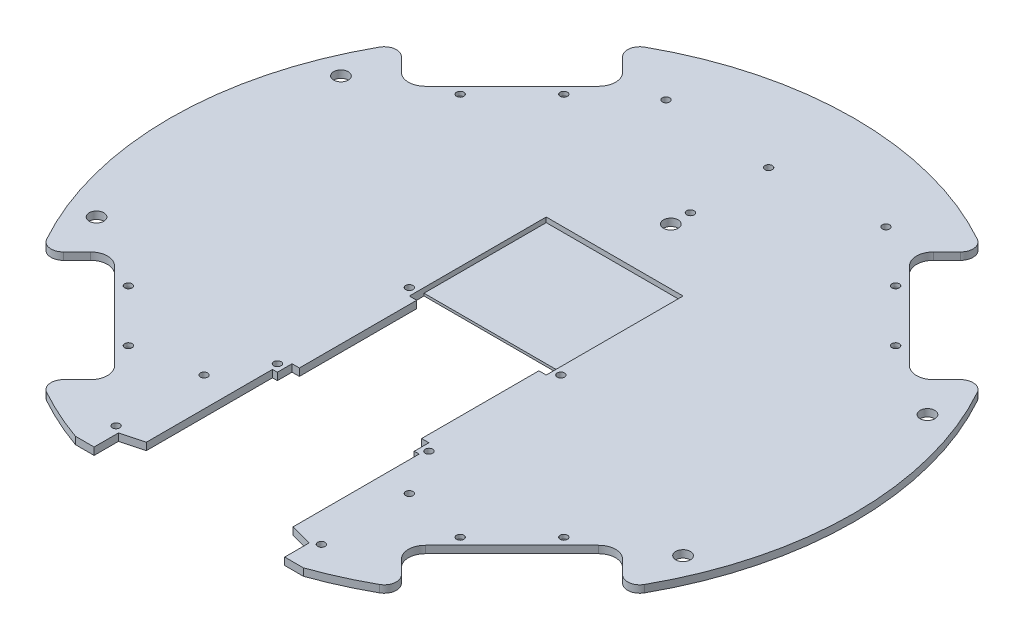
from build123d import *

# Parameters (mm, degrees)
SKETCH1_R                = 140
BOSS_EXTRUDE1_DEPTH      = 3
CUT_EXTRUDE4_REACH       = 200.013
CUT_EXTRUDE6_REACH       = 200.013
SKETCH9_R                = 1.5
FILLET1_R                = 5
CIRPATTERN1_COUNT        = 4
FILLET1_OF_CIRPATTERN1_R = 5
CUT_EXTRUDE1_REACH       = 200.013
FILLET3_R                = 1.5
CUT_EXTRUDE7_REACH       = 200.013
SKETCH10_R               = 1.5
CUT_EXTRUDE9_REACH       = 200.013
SKETCH13_R               = 1.5
CUT_EXTRUDE12_REACH      = 200.013
SKETCH16_R               = 1.5
SKETCH16_R_2             = 3
CUT_EXTRUDE13_REACH      = 200.013
SKETCH17_R               = 3
SKETCH18_W               = 56
SKETCH18_H               = 50
CUT_EXTRUDE14_DEPTH      = 2


with BuildPart() as part:
    # Sketch1 → Boss-Extrude1 (new body)
    with BuildSketch(Plane(origin=(0, 0, 0), x_dir=(1, 0, 0), z_dir=(0, 1, 0))):
        Circle(SKETCH1_R)
    extrude(amount=BOSS_EXTRUDE1_DEPTH)

    # Sketch7 → Cut-Extrude4 (cut, up to next)
    with BuildSketch(Plane(origin=(0, 3, 0), x_dir=(1, 0, 0), z_dir=(0, 1, 0)), mode=Mode.PRIVATE) as cut_extrude4_sk1:
        with BuildLine():
            Line((-99.030304705, -63.604254968), (-63.604254968, -99.030304705))
            ThreePointArc((-63.604254968, -99.030304705), (-61.568647097, -103.944696834), (-63.604254968, -108.859088964))
            Line((-63.604254968, -108.859088964), (-76.367532368, -121.622366364))
            Line((-76.367532368, -121.622366364), (-121.622366364, -76.367532368))
            Line((-121.622366364, -76.367532368), (-108.859088964, -63.604254968))
            ThreePointArc((-108.859088964, -63.604254968), (-103.944696834, -61.568647097), (-99.030304705, -63.604254968))
        make_face()
    cut_extrude4_tool1 = extrude(cut_extrude4_sk1.sketch, amount=-CUT_EXTRUDE4_REACH, mode=Mode.PRIVATE) & part.part
    cut_extrude4 = cut_extrude4_tool1.solids().sort_by_distance((-90.257735, 3, 90.257735))[0]
    add(cut_extrude4, mode=Mode.SUBTRACT)

    # Sketch9 → Cut-Extrude6 (cut, up to next)
    with BuildSketch(Plane(origin=(0, 3, 0), x_dir=(1, 0, 0), z_dir=(0, 1, 0)), mode=Mode.PRIVATE) as cut_extrude6_sk1:
        with Locations((-89.09545443, -67.882250994)):
            Circle(SKETCH9_R)
    cut_extrude6_tool1 = extrude(cut_extrude6_sk1.sketch, amount=-CUT_EXTRUDE6_REACH, mode=Mode.PRIVATE) & part.part
    # Sketch9 → Cut-Extrude6 (cut, up to next)
    with BuildSketch(Plane(origin=(0, 3, 0), x_dir=(1, 0, 0), z_dir=(0, 1, 0)), mode=Mode.PRIVATE) as cut_extrude6_sk2:
        with Locations((-67.882250994, -89.09545443)):
            Circle(SKETCH9_R)
    cut_extrude6_tool2 = extrude(cut_extrude6_sk2.sketch, amount=-CUT_EXTRUDE6_REACH, mode=Mode.PRIVATE) & part.part
    cut_extrude6_1 = cut_extrude6_tool1.solids().sort_by_distance((-89.095454, 3, 67.882251))[0]
    add(cut_extrude6_1, mode=Mode.SUBTRACT)
    cut_extrude6_2 = cut_extrude6_tool2.solids().sort_by_distance((-67.882251, 3, 89.095454))[0]
    add(cut_extrude6_2, mode=Mode.SUBTRACT)
    cut_extrude6 = cut_extrude6_1 + cut_extrude6_2  # Cut-Extrude6 as one shape, for the pattern or mirror that repeats it

    # Fillet1
    fillet1_edges = [part.edges().sort_by_distance(p)[0] for p in [
        (-73.746853427, 1.5, 119.001687423),
        (-119.001687423, 1.5, 73.746853427),
    ]]
    fillet(fillet1_edges, radius=FILLET1_R)

    # CirPattern1: Cut-Extrude4, Cut-Extrude6 ×4 about axis
    cirpattern1_axis = Axis((0, 3, 0), (0, 1, 0))
    add([cut_extrude4.rotate(cirpattern1_axis, i * 360 / CIRPATTERN1_COUNT) for i in range(1, CIRPATTERN1_COUNT)], mode=Mode.SUBTRACT)
    add([cut_extrude6.rotate(cirpattern1_axis, i * 360 / CIRPATTERN1_COUNT) for i in range(1, CIRPATTERN1_COUNT)], mode=Mode.SUBTRACT)

    # Fillet1 of CirPattern1
    fillet1_of_cirpattern1_edges = [part.edges().sort_by_distance(p)[0] for p in [
        (119.001687423, 1.5, 73.746853427),
        (73.746853427, 1.5, 119.001687423),
        (73.746853427, 1.5, -119.001687423),
        (119.001687423, 1.5, -73.746853427),
        (-119.001687423, 1.5, -73.746853427),
        (-73.746853427, 1.5, -119.001687423),
    ]]
    fillet(fillet1_of_cirpattern1_edges, radius=FILLET1_OF_CIRPATTERN1_R)

    # Sketch2 → Cut-Extrude1 (cut, up to next)
    with BuildSketch(Plane(origin=(0, 3, 0), x_dir=(1, 0, 0), z_dir=(0, 1, 0)), mode=Mode.PRIVATE) as cut_extrude1_sk1:
        Polygon((-46.647615159, -132), (-39, -132), (-39, -122), (-30, -119.588457268), (-30, -68), (-28, -68), (-28, -62), (-25, -62), (-25, -14), (-28, -14), (-28, -8), (28, -8), (28, -14), (25, -14), (25, -62), (28, -62), (28, -68), (30, -68), (30, -119.588457268), (39, -122), (39, -132), (46.647615159, -132), (46.647615159, -140), (-46.647615159, -140), align=None)
    cut_extrude1_tool1 = extrude(cut_extrude1_sk1.sketch, amount=-CUT_EXTRUDE1_REACH, mode=Mode.PRIVATE) & part.part
    add(cut_extrude1_tool1.solids().sort_by_distance((0, 3, 79.863408))[0], mode=Mode.SUBTRACT)

    # Fillet3
    fillet3_edges = [part.edges().sort_by_distance(p)[0] for p in [
        (67.882250994, 0, 90.59545443),
        (89.09545443, 0, 69.382250994),
        (90.59545443, 0, -67.882250994),
        (69.382250994, 0, -89.09545443),
        (-67.882250994, 0, -90.59545443),
        (-89.09545443, 0, -69.382250994),
        (-69.382250994, 0, 89.09545443),
        (-90.59545443, 0, 67.882250994),
    ]]
    fillet(fillet3_edges, radius=FILLET3_R)

    # Sketch10 → Cut-Extrude7 (cut, up to next)
    with BuildSketch(Plane(origin=(0, 3, 0), x_dir=(1, 0, 0), z_dir=(0, 1, 0)), mode=Mode.PRIVATE) as cut_extrude7_sk1:
        with Locations((-31, -65)):
            Circle(SKETCH10_R)
    cut_extrude7_tool1 = extrude(cut_extrude7_sk1.sketch, amount=-CUT_EXTRUDE7_REACH, mode=Mode.PRIVATE) & part.part
    # Sketch10 → Cut-Extrude7 (cut, up to next)
    with BuildSketch(Plane(origin=(0, 3, 0), x_dir=(1, 0, 0), z_dir=(0, 1, 0)), mode=Mode.PRIVATE) as cut_extrude7_sk2:
        with Locations((31, -65)):
            Circle(SKETCH10_R)
    cut_extrude7_tool2 = extrude(cut_extrude7_sk2.sketch, amount=-CUT_EXTRUDE7_REACH, mode=Mode.PRIVATE) & part.part
    # Sketch10 → Cut-Extrude7 (cut, up to next)
    with BuildSketch(Plane(origin=(0, 3, 0), x_dir=(1, 0, 0), z_dir=(0, 1, 0)), mode=Mode.PRIVATE) as cut_extrude7_sk3:
        with Locations((-31, -11)):
            Circle(SKETCH10_R)
    cut_extrude7_tool3 = extrude(cut_extrude7_sk3.sketch, amount=-CUT_EXTRUDE7_REACH, mode=Mode.PRIVATE) & part.part
    # Sketch10 → Cut-Extrude7 (cut, up to next)
    with BuildSketch(Plane(origin=(0, 3, 0), x_dir=(1, 0, 0), z_dir=(0, 1, 0)), mode=Mode.PRIVATE) as cut_extrude7_sk4:
        with Locations((31, -11)):
            Circle(SKETCH10_R)
    cut_extrude7_tool4 = extrude(cut_extrude7_sk4.sketch, amount=-CUT_EXTRUDE7_REACH, mode=Mode.PRIVATE) & part.part
    add(cut_extrude7_tool1.solids().sort_by_distance((-31, 3, 65))[0], mode=Mode.SUBTRACT)
    add(cut_extrude7_tool2.solids().sort_by_distance((31, 3, 65))[0], mode=Mode.SUBTRACT)
    add(cut_extrude7_tool3.solids().sort_by_distance((-31, 3, 11))[0], mode=Mode.SUBTRACT)
    add(cut_extrude7_tool4.solids().sort_by_distance((31, 3, 11))[0], mode=Mode.SUBTRACT)

    # Sketch13 → Cut-Extrude9 (cut, up to next)
    with BuildSketch(Plane(origin=(0, 3, 0), x_dir=(1, 0, 0), z_dir=(0, 1, 0)), mode=Mode.PRIVATE) as cut_extrude9_sk1:
        with Locations((-42, -84)):
            Circle(SKETCH13_R)
    cut_extrude9_tool1 = extrude(cut_extrude9_sk1.sketch, amount=-CUT_EXTRUDE9_REACH, mode=Mode.PRIVATE) & part.part
    # Sketch13 → Cut-Extrude9 (cut, up to next)
    with BuildSketch(Plane(origin=(0, 3, 0), x_dir=(1, 0, 0), z_dir=(0, 1, 0)), mode=Mode.PRIVATE) as cut_extrude9_sk2:
        with Locations((-42, -120)):
            Circle(SKETCH13_R)
    cut_extrude9_tool2 = extrude(cut_extrude9_sk2.sketch, amount=-CUT_EXTRUDE9_REACH, mode=Mode.PRIVATE) & part.part
    # Sketch13 → Cut-Extrude9 (cut, up to next)
    with BuildSketch(Plane(origin=(0, 3, 0), x_dir=(1, 0, 0), z_dir=(0, 1, 0)), mode=Mode.PRIVATE) as cut_extrude9_sk3:
        with Locations((42, -120)):
            Circle(SKETCH13_R)
    cut_extrude9_tool3 = extrude(cut_extrude9_sk3.sketch, amount=-CUT_EXTRUDE9_REACH, mode=Mode.PRIVATE) & part.part
    # Sketch13 → Cut-Extrude9 (cut, up to next)
    with BuildSketch(Plane(origin=(0, 3, 0), x_dir=(1, 0, 0), z_dir=(0, 1, 0)), mode=Mode.PRIVATE) as cut_extrude9_sk4:
        with Locations((42, -84)):
            Circle(SKETCH13_R)
    cut_extrude9_tool4 = extrude(cut_extrude9_sk4.sketch, amount=-CUT_EXTRUDE9_REACH, mode=Mode.PRIVATE) & part.part
    add(cut_extrude9_tool1.solids().sort_by_distance((-42, 3, 84))[0], mode=Mode.SUBTRACT)
    add(cut_extrude9_tool2.solids().sort_by_distance((-42, 3, 120))[0], mode=Mode.SUBTRACT)
    add(cut_extrude9_tool3.solids().sort_by_distance((42, 3, 120))[0], mode=Mode.SUBTRACT)
    add(cut_extrude9_tool4.solids().sort_by_distance((42, 3, 84))[0], mode=Mode.SUBTRACT)

    # Sketch16 → Cut-Extrude12 (cut, up to next)
    with BuildSketch(Plane(origin=(0, 3, 0), x_dir=(1, 0, 0), z_dir=(0, 1, 0)), mode=Mode.PRIVATE) as cut_extrude12_sk1:
        with Locations((0, 73)):
            Circle(SKETCH16_R)
    cut_extrude12_tool1 = extrude(cut_extrude12_sk1.sketch, amount=-CUT_EXTRUDE12_REACH, mode=Mode.PRIVATE) & part.part
    # Sketch16 → Cut-Extrude12 (cut, up to next)
    with BuildSketch(Plane(origin=(0, 3, 0), x_dir=(1, 0, 0), z_dir=(0, 1, 0)), mode=Mode.PRIVATE) as cut_extrude12_sk2:
        with Locations((-45, 108)):
            Circle(SKETCH16_R)
    cut_extrude12_tool2 = extrude(cut_extrude12_sk2.sketch, amount=-CUT_EXTRUDE12_REACH, mode=Mode.PRIVATE) & part.part
    # Sketch16 → Cut-Extrude12 (cut, up to next)
    with BuildSketch(Plane(origin=(0, 3, 0), x_dir=(1, 0, 0), z_dir=(0, 1, 0)), mode=Mode.PRIVATE) as cut_extrude12_sk3:
        with Locations((45, 108)):
            Circle(SKETCH16_R)
    cut_extrude12_tool3 = extrude(cut_extrude12_sk3.sketch, amount=-CUT_EXTRUDE12_REACH, mode=Mode.PRIVATE) & part.part
    # Sketch16 → Cut-Extrude12 (cut, up to next)
    with BuildSketch(Plane(origin=(0, 3, 0), x_dir=(1, 0, 0), z_dir=(0, 1, 0)), mode=Mode.PRIVATE) as cut_extrude12_sk4:
        with Locations((0, 105)):
            Circle(SKETCH16_R)
    cut_extrude12_tool4 = extrude(cut_extrude12_sk4.sketch, amount=-CUT_EXTRUDE12_REACH, mode=Mode.PRIVATE) & part.part
    # Sketch16 → Cut-Extrude12 (cut, up to next)
    with BuildSketch(Plane(origin=(0, 3, 0), x_dir=(1, 0, 0), z_dir=(0, 1, 0)), mode=Mode.PRIVATE) as cut_extrude12_sk5:
        with Locations((0, 65)):
            Circle(SKETCH16_R_2)
    cut_extrude12_tool5 = extrude(cut_extrude12_sk5.sketch, amount=-CUT_EXTRUDE12_REACH, mode=Mode.PRIVATE) & part.part
    add(cut_extrude12_tool1.solids().sort_by_distance((0, 3, -73))[0], mode=Mode.SUBTRACT)
    add(cut_extrude12_tool2.solids().sort_by_distance((-45, 3, -108))[0], mode=Mode.SUBTRACT)
    add(cut_extrude12_tool3.solids().sort_by_distance((45, 3, -108))[0], mode=Mode.SUBTRACT)
    add(cut_extrude12_tool4.solids().sort_by_distance((0, 3, -105))[0], mode=Mode.SUBTRACT)
    add(cut_extrude12_tool5.solids().sort_by_distance((0, 3, -65))[0], mode=Mode.SUBTRACT)

    # Sketch17 → Cut-Extrude13 (cut, up to next)
    with BuildSketch(Plane(origin=(0, 3, 0), x_dir=(1, 0, 0), z_dir=(0, 1, 0)), mode=Mode.PRIVATE) as cut_extrude13_sk1:
        with Locations((-120, 50)):
            Circle(SKETCH17_R)
    cut_extrude13_tool1 = extrude(cut_extrude13_sk1.sketch, amount=-CUT_EXTRUDE13_REACH, mode=Mode.PRIVATE) & part.part
    # Sketch17 → Cut-Extrude13 (cut, up to next)
    with BuildSketch(Plane(origin=(0, 3, 0), x_dir=(1, 0, 0), z_dir=(0, 1, 0)), mode=Mode.PRIVATE) as cut_extrude13_sk2:
        with Locations((-120, -50)):
            Circle(SKETCH17_R)
    cut_extrude13_tool2 = extrude(cut_extrude13_sk2.sketch, amount=-CUT_EXTRUDE13_REACH, mode=Mode.PRIVATE) & part.part
    # Sketch17 → Cut-Extrude13 (cut, up to next)
    with BuildSketch(Plane(origin=(0, 3, 0), x_dir=(1, 0, 0), z_dir=(0, 1, 0)), mode=Mode.PRIVATE) as cut_extrude13_sk3:
        with Locations((120, 50)):
            Circle(SKETCH17_R)
    cut_extrude13_tool3 = extrude(cut_extrude13_sk3.sketch, amount=-CUT_EXTRUDE13_REACH, mode=Mode.PRIVATE) & part.part
    # Sketch17 → Cut-Extrude13 (cut, up to next)
    with BuildSketch(Plane(origin=(0, 3, 0), x_dir=(1, 0, 0), z_dir=(0, 1, 0)), mode=Mode.PRIVATE) as cut_extrude13_sk4:
        with Locations((120, -50)):
            Circle(SKETCH17_R)
    cut_extrude13_tool4 = extrude(cut_extrude13_sk4.sketch, amount=-CUT_EXTRUDE13_REACH, mode=Mode.PRIVATE) & part.part
    add(cut_extrude13_tool1.solids().sort_by_distance((-120, 3, -50))[0], mode=Mode.SUBTRACT)
    add(cut_extrude13_tool2.solids().sort_by_distance((-120, 3, 50))[0], mode=Mode.SUBTRACT)
    add(cut_extrude13_tool3.solids().sort_by_distance((120, 3, -50))[0], mode=Mode.SUBTRACT)
    add(cut_extrude13_tool4.solids().sort_by_distance((120, 3, 50))[0], mode=Mode.SUBTRACT)

    # Sketch18 → Cut-Extrude14 (cut)
    with BuildSketch(Plane(origin=(0, 3, 0), x_dir=(1, 0, 0), z_dir=(0, 1, 0))):
        with Locations((0, 17)):
            Rectangle(SKETCH18_W, SKETCH18_H)
    extrude(amount=-CUT_EXTRUDE14_DEPTH, mode=Mode.SUBTRACT)


solid = part.part
